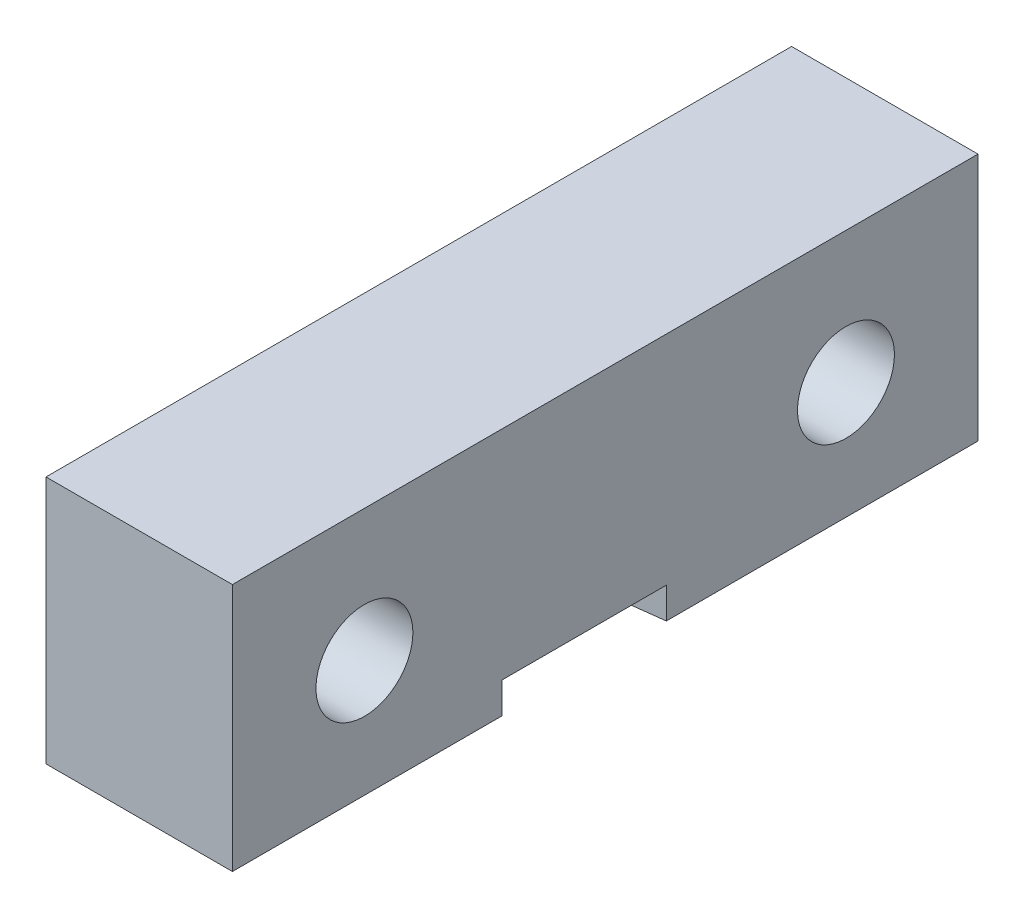
from build123d import *

# Parameters (mm, degrees)
SKETCH1_W           = 38.1
SKETCH1_H           = 50.8
BOSS_EXTRUDE1_DEPTH = 76.2
CUT_EXTRUDE1_REACH  = 90.9
SKETCH2_R           = 6.731
SKETCH3_R           = 9.906
CUT_EXTRUDE2_DEPTH  = 38.608
CUT_EXTRUDE3_DEPTH  = 6.35
SKETCH5_R           = 12.0142
CUT_EXTRUDE4_DEPTH  = 3.81
SKETCH6_R           = 14.6812
CUT_EXTRUDE5_DEPTH  = 1.5875


with BuildPart() as part:
    # Sketch1 → Boss-Extrude1 (new, symmetric)
    with BuildSketch(Plane.XY):
        Rectangle(SKETCH1_W, SKETCH1_H)
    extrude(amount=BOSS_EXTRUDE1_DEPTH, both=True)

    # Sketch2 → Cut-Extrude1 (cut, up to next)
    with BuildSketch(Plane(origin=(19.05, 0, 0), x_dir=(0, 0, -1), z_dir=(1, 0, 0)), mode=Mode.PRIVATE) as cut_extrude1_sk1:
        with Locations((-49.2125, -1.524)):
            Circle(SKETCH2_R)
    cut_extrude1_tool1 = extrude(cut_extrude1_sk1.sketch, amount=-CUT_EXTRUDE1_REACH, mode=Mode.PRIVATE) & part.part
    # Sketch2 → Cut-Extrude1 (cut, up to next)
    with BuildSketch(Plane(origin=(19.05, 0, 0), x_dir=(0, 0, -1), z_dir=(1, 0, 0)), mode=Mode.PRIVATE) as cut_extrude1_sk2:
        with Locations((49.2125, -1.524)):
            Circle(SKETCH2_R)
    cut_extrude1_tool2 = extrude(cut_extrude1_sk2.sketch, amount=-CUT_EXTRUDE1_REACH, mode=Mode.PRIVATE) & part.part
    add(cut_extrude1_tool1.solids().sort_by_distance((19.05, -1.524, 49.2125))[0], mode=Mode.SUBTRACT)
    add(cut_extrude1_tool2.solids().sort_by_distance((19.05, -1.524, -49.2125))[0], mode=Mode.SUBTRACT)

    # Sketch3 → Cut-Extrude2 (cut)
    with BuildSketch(Plane(origin=(19.05, 0, 0), x_dir=(0, 0, -1), z_dir=(1, 0, 0))):
        with Locations((-49.2125, -1.524)):
            Circle(SKETCH3_R)
        with Locations((49.2125, -1.524)):
            Circle(SKETCH3_R)
    extrude(amount=-CUT_EXTRUDE2_DEPTH, mode=Mode.SUBTRACT)

    # Sketch4 → Cut-Extrude3 (cut)
    with BuildSketch(Plane.XZ.offset(25.4)):
        with BuildLine():
            Line((19.05, -12.496061565), (19.05, 21.137585496))
            Line((19.05, 21.137585496), (0.947246364, 18.89010908))
            ThreePointArc((0.947246364, 18.89010908), (-11.925153457, 4.320761965), (0.947246364, -10.248585149))
            Line((0.947246364, -10.248585149), (19.05, -12.496061565))
        make_face()
    extrude(amount=-CUT_EXTRUDE3_DEPTH, mode=Mode.SUBTRACT)

    # Sketch5 → Cut-Extrude4 (cut)
    with BuildSketch(Plane.XZ.offset(19.05)):
        with Locations((2.756046543, 4.320761965)):
            Circle(SKETCH5_R)
    extrude(amount=-CUT_EXTRUDE4_DEPTH, mode=Mode.SUBTRACT)

    # Sketch6 → Cut-Extrude5 (cut)
    with BuildSketch(Plane.XZ.offset(19.05)):
        with Locations((2.756046543, 4.320761965)):
            Circle(SKETCH6_R)
    extrude(amount=-CUT_EXTRUDE5_DEPTH, mode=Mode.SUBTRACT)


solid = part.part
